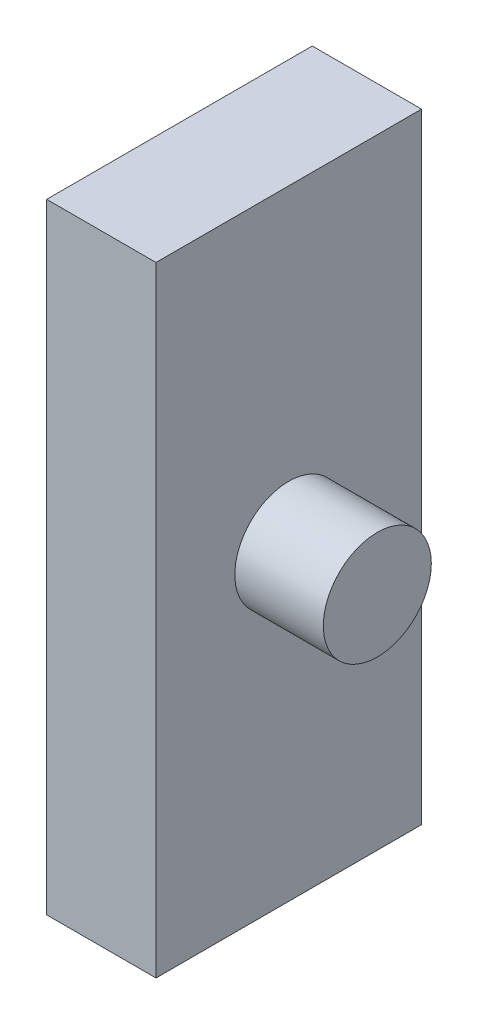
from build123d import *

# Parameters (mm, degrees)
SKETCH1_W           = 15
SKETCH1_H           = 35
SKETCH1_W_2         = 3.375
SKETCH1_H_2         = 17
BOSS_EXTRUDE1_DEPTH = 4.175
SKETCH2_W           = 15
SKETCH2_H           = 35
BOSS_EXTRUDE2_DEPTH = 2
SKETCH3_R           = 3.05
BOSS_EXTRUDE3_DEPTH = 5


with BuildPart() as part:
    # Sketch1 → Boss-Extrude1 (new body)
    with BuildSketch(Plane(origin=(0, 0, 0), x_dir=(0, 0, -1), z_dir=(1, 0, 0))):
        with Locations((7.5, 17.5)):
            Rectangle(SKETCH1_W, SKETCH1_H)
        with Locations((7.5, 17.5)):
            Rectangle(SKETCH1_W_2, SKETCH1_H_2, mode=Mode.SUBTRACT)
    extrude(amount=BOSS_EXTRUDE1_DEPTH)

    # Sketch2 → Boss-Extrude2 (add)
    with BuildSketch(Plane(origin=(4.175, 0, 0), x_dir=(0, 0, -1), z_dir=(1, 0, 0))):
        with Locations((7.5, 17.5)):
            Rectangle(SKETCH2_W, SKETCH2_H)
    extrude(amount=BOSS_EXTRUDE2_DEPTH)

    # Sketch3 → Boss-Extrude3 (add)
    with BuildSketch(Plane(origin=(6.175, 0, 0), x_dir=(0, 0, -1), z_dir=(1, 0, 0))):
        with Locations((7.5, 17.5)):
            Circle(SKETCH3_R)
    extrude(amount=BOSS_EXTRUDE3_DEPTH)


solid = part.part
